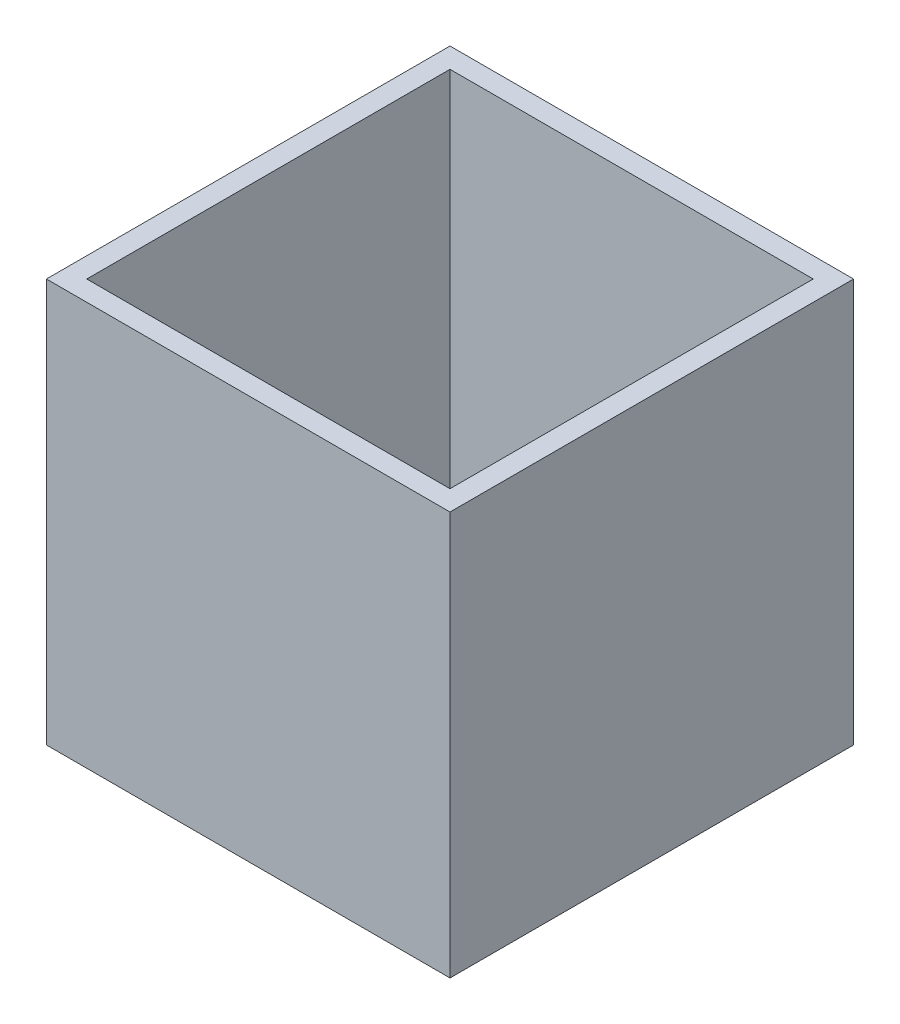
from build123d import *

# Parameters (mm, degrees)
SKETCH1_W           = 20
SKETCH1_H           = 20
BOSS_EXTRUDE1_DEPTH = 20
SHELL1_T            = -1
SKETCH2_R           = 0.5
SKETCH2_R_2         = 3
CUT_EXTRUDE1_DEPTH  = 35.641016151
SKETCH3_W           = 4.062140824
SKETCH3_H           = 0.6
CUT_EXTRUDE2_DEPTH  = 10


with BuildPart() as part:
    # Sketch1 → Boss-Extrude1 (new body)
    with BuildSketch(Plane(origin=(0, 0, 0), x_dir=(1, 0, 0), z_dir=(0, 1, 0))):
        with Locations((-10, 10)):
            Rectangle(SKETCH1_W, SKETCH1_H)
    extrude(amount=BOSS_EXTRUDE1_DEPTH)

    # Shell1
    shell1_openings = [part.faces().sort_by_distance(p)[0] for p in [
        (-10, 20, -10),
    ]]
    offset(amount=SHELL1_T, openings=shell1_openings, kind=Kind.INTERSECTION)

    # Sketch2 → Cut-Extrude1 (cut, through all)
    with BuildSketch(Plane.XZ):
        with Locations((-14.453403979, -15.01440787)):
            Circle(SKETCH2_R)
        with Locations((-10.070288127, -9.183331165)):
            Circle(SKETCH2_R_2)
    extrude(amount=-CUT_EXTRUDE1_DEPTH, mode=Mode.SUBTRACT)

    # Sketch3 → Cut-Extrude2 (cut)
    with BuildSketch(Plane(origin=(0, 0, 0), x_dir=(-1, 0, 0), z_dir=(0, -1, 0))):
        with Locations((3.932732484, 4.621416118)):
            Rectangle(SKETCH3_W, SKETCH3_H)
    extrude(amount=-CUT_EXTRUDE2_DEPTH, mode=Mode.SUBTRACT)


solid = part.part
